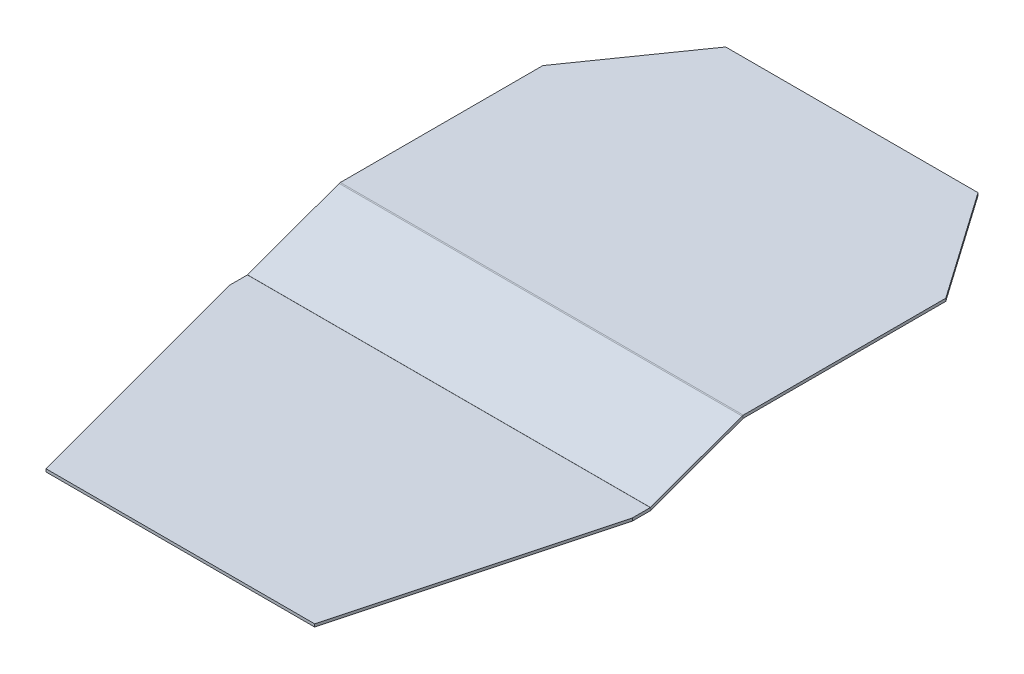
from build123d import *

# Parameters (mm, degrees)
BASE_FLANGE1_DEPTH      = 457.2
CUT_EXTRUDE1_DEPTH      = 648.7
CUT_EXTRUDE1_DEPTH_BACK = 648.7


# Sheet-metal steps are written as plain solids
with BuildPart() as part:
    # Sketch1 → Base-Flange1 (new body)
    with BuildSketch(Plane(origin=(0, 0, 0), x_dir=(0, 0, -1), z_dir=(1, 0, 0))):
        with BuildLine():
            Line((-304.8, 0), (-0.129882454, 0))
            ThreePointArc((-0.129882454, 0), (-0.001973206, 0.011190609), (0.122049584, 0.044422416))
            Line((0.122049584, 0.044422416), (104.030764306, 37.864101655))
            ThreePointArc((104.030764306, 37.864101655), (104.689368087, 38.040574007), (105.368610299, 38.1))
            Line((105.368610299, 38.1), (457.2, 38.1))
            Line((457.2, 38.1), (457.2, 34.925))
            Line((457.2, 34.925), (105.368610299, 34.925))
            ThreePointArc((105.368610299, 34.925), (105.240701051, 34.913809391), (105.116678261, 34.880577584))
            Line((105.116678261, 34.880577584), (1.207963539, -2.939101655))
            ThreePointArc((1.207963539, -2.939101655), (0.549359758, -3.115574007), (-0.129882454, -3.175))
            Line((-0.129882454, -3.175), (-304.8, -3.175))
            Line((-304.8, -3.175), (-304.8, 0))
        make_face()
    extrude(amount=BASE_FLANGE1_DEPTH)

    # Sketch6 → Cut-Extrude1 (cut, two sides: drawn at the far end of the back side and taken through both)
    with BuildSketch(Plane(origin=(0, 0, 0), x_dir=(1, 0, 0), z_dir=(0, 1, 0)).offset(-CUT_EXTRUDE1_DEPTH_BACK)):
        Polygon((0, -304.8), (76.2, -304.8), (0, -20.417728463), align=None)
        Polygon((0, 335.182271537), (0, 457.2), (85.437733265, 457.2), align=None)
        Polygon((457.2, 457.2), (371.762266735, 457.2), (457.2, 335.182271537), align=None)
        Polygon((381, -304.8), (457.2, -20.417728463), (457.2, -304.8), align=None)
    extrude(amount=CUT_EXTRUDE1_DEPTH + CUT_EXTRUDE1_DEPTH_BACK, mode=Mode.SUBTRACT)


solid = part.part
